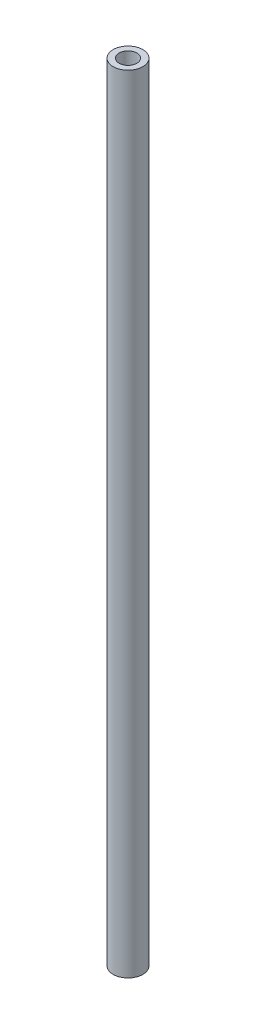
from build123d import *

# Parameters (mm, degrees)
SKETCH1_R           = 2
SKETCH1_R_2         = 1.2
BOSS_EXTRUDE1_DEPTH = 106


with BuildPart() as part:
    # Sketch1 → Boss-Extrude1 (new body)
    with BuildSketch(Plane(origin=(0, 0, 0), x_dir=(1, 0, 0), z_dir=(0, 1, 0))):
        Circle(SKETCH1_R)
        Circle(SKETCH1_R_2, mode=Mode.SUBTRACT)
    extrude(amount=BOSS_EXTRUDE1_DEPTH)


solid = part.part
